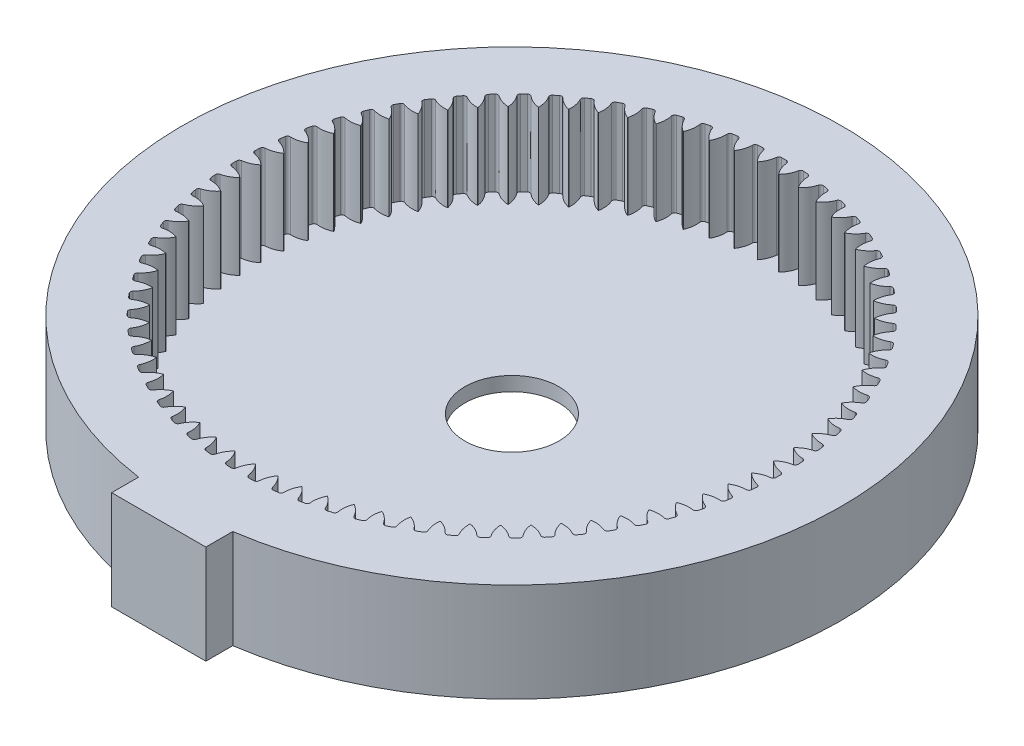
from build123d import *

# Parameters (mm, degrees)
SKETCH1_R                = 70
SKETCH1_R_2              = 54.47
BOSS_EXTRUDE1_DEPTH      = 18
CUT_EXTRUDE1_DEPTH       = 101.618089825
FILLET1_R                = 0.57
CIRPATTERN1_COUNT        = 75
FILLET1_OF_CIRPATTERN1_R = 0.57
BOSS_EXTRUDE2_START      = -3
SKETCH4_R                = 70
BOSS_EXTRUDE2_DEPTH      = 3
CUT_EXTRUDE2_REACH       = 103.198
SKETCH5_R                = 10
SKETCH6_W                = 20
SKETCH6_H                = 8.202228863
BOSS_EXTRUDE3_DEPTH      = 21
SCALE1_SCALE             = 10


with BuildPart() as part:
    # Sketch1 → Boss-Extrude1 (new body)
    with BuildSketch(Plane(origin=(0, 0, 0), x_dir=(1, 0, 0), z_dir=(0, 1, 0))):
        with Locations(Location((0, 0, 0), (0, 0, 270))):
            Circle(SKETCH1_R)
        with Locations(Location((0, 0, 0), (0, 0, 270))):
            Circle(SKETCH1_R_2, mode=Mode.SUBTRACT)
    extrude(amount=BOSS_EXTRUDE1_DEPTH)

    # Sketch2 → Cut-Extrude1 (cut, through all)
    with BuildSketch(Plane(origin=(0, 0, 0), x_dir=(1, 0, 0), z_dir=(0, 1, 0))):
        with BuildLine():
            ThreePointArc((2.253249833, 54.41897462), (1.367107137, 55.988197892), (1.037254549, 57.759894206))
            ThreePointArc((1.037254549, 57.759894206), (0, 57.769206985), (-1.037254549, 57.759894206))
            ThreePointArc((-1.037254549, 57.759894206), (-1.367107137, 55.988197892), (-2.253249833, 54.41897462))
            ThreePointArc((-2.253249833, 54.41897462), (0, 54.465603214), (2.253249833, 54.41897462))
        make_face()
    cut_extrude1 = extrude(amount=CUT_EXTRUDE1_DEPTH, mode=Mode.SUBTRACT)

    # Fillet1
    fillet1_edges = [part.edges().sort_by_distance(p)[0] for p in [
        (1.037254549, 9, -57.759894206),
        (-1.037254549, 9, -57.759894206),
    ]]
    fillet(fillet1_edges, radius=FILLET1_R)

    # CirPattern1: Cut-Extrude1 ×75 about axis
    cirpattern1_axis = Axis((0, 0, 0), (0, 1, 0))
    for i in range(1, CIRPATTERN1_COUNT):
        add(cut_extrude1.rotate(cirpattern1_axis, i * 360 / CIRPATTERN1_COUNT), mode=Mode.SUBTRACT)

    # Fillet1 of CirPattern1
    fillet1_of_cirpattern1_edges = [part.edges().sort_by_distance(p)[0] for p in [
        (-3.799606627, 9, -57.644117351),
        (-5.86684013, 9, -57.470526904),
        (-8.609816292, 9, -57.12400843),
        (-10.655274042, 9, -56.778045147),
        (-13.359634283, 9, -56.203215633),
        (-15.368968863, 9, -55.6873062),
        (-18.015744037, 9, -54.888197661),
        (-19.974861409, 9, -54.20596081),
        (-22.545486292, 9, -53.188178419),
        (-24.440644655, 9, -52.344399552),
        (-26.917088159, 9, -51.115082321),
        (-28.73499434, 9, -50.115679941),
        (-31.099885993, 9, -48.683450647),
        (-32.827788685, 9, -47.535434843),
        (-35.064540471, 9, -45.910339546),
        (-36.690319679, 9, -44.621762824),
        (-38.783242393, 9, -42.815200399),
        (-40.295494442, 9, -41.3951012),
        (-42.229907734, 9, -39.419743384),
        (-43.618025265, 9, -37.878082682),
        (-45.380360615, 9, -35.747785192),
        (-46.634606979, 9, -34.095376631),
        (-48.212502872, 9, -31.825081972),
        (-49.324080433, 9, -30.073516009),
        (-50.706469061, 9, -27.679148668),
        (-51.667580901, 9, -25.840711281),
        (-52.844765803, 9, -23.339066024),
        (-53.648670413, 9, -21.426652529),
        (-54.612394482, 9, -18.835276601),
        (-55.253453048, 9, -16.862301205),
        (-55.996956452, 9, -14.199371245),
        (-56.47067241, 9, -12.179672954),
        (-56.988740007, 9, -9.463867503),
        (-57.291790579, 9, -7.411613047),
        (-57.580788497, 9, -4.661981529),
        (-57.711048001, 9, -2.591566001),
        (-57.768949127, 9, 0.172604895),
        (-57.725503886, 9, 2.246659019),
        (-57.551902086, 9, 5.00598062),
        (-57.335056838, 9, 7.06912534),
        (-56.931169803, 9, 9.804242987),
        (-56.542445561, 9, 11.842006826),
        (-55.911106269, 9, 14.533735635),
        (-55.353229654, 9, 16.531825142),
        (-54.498866496, 9, 19.161284569),
        (-53.775750612, 9, 21.105684584),
        (-52.704356332, 9, 23.65443086),
        (-51.821073318, 9, 25.531502812),
        (-50.540162977, 9, 27.981658313),
        (-49.502908428, 9, 29.778235893),
        (-48.021466691, 9, 32.112614539),
        (-46.837516203, 9, 33.816096044),
        (-45.16593432, 9, 36.018323846),
        (-43.843592454, 9, 37.616760578),
        (-41.993595371, 9, 39.671390491),
        (-40.542137406, 9, 41.153570565),
        (-38.526701523, 9, 43.046190835),
        (-36.956308393, 9, 44.401717823),
        (-34.789570546, 9, 46.119053079),
        (-33.111257431, 9, 47.338418933),
        (-30.808415727, 9, 48.868423302),
        (-29.033954787, 9, 49.943075046),
        (-26.611162008, 9, 51.275016648),
        (-24.752999812, 9, 52.197416373),
        (-22.227250107, 9, 53.321952593),
        (-20.298420328, 9, 54.085630327),
        (-17.687430017, 9, 54.994873353),
        (-15.70146201, 9, 55.594472445),
        (-13.023545314, 9, 56.282044589),
        (-10.994369217, 9, 56.713359283),
        (-8.268309798, 9, 57.174437721),
        (-6.210158824, 9, 57.434442655),
        (-3.45507803, 9, 57.665793253),
        (-1.382388629, 9, 57.752664678),
        (1.382388629, 9, 57.752664678),
        (3.45507803, 9, 57.665793253),
        (6.210158824, 9, 57.434442655),
        (8.268309798, 9, 57.174437721),
        (10.994369217, 9, 56.713359283),
        (13.023545314, 9, 56.282044589),
        (15.70146201, 9, 55.594472445),
        (17.687430017, 9, 54.994873353),
        (20.298420328, 9, 54.085630327),
        (22.227250107, 9, 53.321952593),
        (24.752999812, 9, 52.197416373),
        (26.611162008, 9, 51.275016648),
        (29.033954787, 9, 49.943075046),
        (30.808415727, 9, 48.868423302),
        (33.111257431, 9, 47.338418933),
        (34.789570546, 9, 46.119053079),
        (36.956308393, 9, 44.401717823),
        (38.526701523, 9, 43.046190835),
        (40.542137406, 9, 41.153570565),
        (41.993595371, 9, 39.671390491),
        (43.843592454, 9, 37.616760578),
        (45.16593432, 9, 36.018323846),
        (46.837516203, 9, 33.816096044),
        (48.021466691, 9, 32.112614539),
        (49.502908428, 9, 29.778235893),
        (50.540162977, 9, 27.981658313),
        (51.821073318, 9, 25.531502812),
        (52.704356332, 9, 23.65443086),
        (53.775750612, 9, 21.105684584),
        (54.498866496, 9, 19.161284569),
        (55.353229654, 9, 16.531825142),
        (55.911106269, 9, 14.533735635),
        (56.542445561, 9, 11.842006826),
        (56.931169803, 9, 9.804242987),
        (57.335056838, 9, 7.06912534),
        (57.551902086, 9, 5.00598062),
        (57.725503886, 9, 2.246659019),
        (57.768949127, 9, 0.172604895),
        (57.711048001, 9, -2.591566001),
        (57.580788497, 9, -4.661981529),
        (57.291790579, 9, -7.411613047),
        (56.988740007, 9, -9.463867503),
        (56.47067241, 9, -12.179672954),
        (55.996956452, 9, -14.199371245),
        (55.253453048, 9, -16.862301205),
        (54.612394482, 9, -18.835276601),
        (53.648670413, 9, -21.426652529),
        (52.844765803, 9, -23.339066024),
        (51.667580901, 9, -25.840711281),
        (50.706469061, 9, -27.679148668),
        (49.324080433, 9, -30.073516009),
        (48.212502872, 9, -31.825081972),
        (46.634606979, 9, -34.095376631),
        (45.380360615, 9, -35.747785192),
        (43.618025265, 9, -37.878082682),
        (42.229907734, 9, -39.419743384),
        (40.295494442, 9, -41.3951012),
        (38.783242393, 9, -42.815200399),
        (36.690319679, 9, -44.621762824),
        (35.064540471, 9, -45.910339546),
        (32.827788685, 9, -47.535434843),
        (31.099885993, 9, -48.683450647),
        (28.73499434, 9, -50.115679941),
        (26.917088159, 9, -51.115082321),
        (24.440644655, 9, -52.344399552),
        (22.545486292, 9, -53.188178419),
        (19.974861409, 9, -54.20596081),
        (18.015744037, 9, -54.888197661),
        (15.368968863, 9, -55.6873062),
        (13.359634283, 9, -56.203215633),
        (10.655274042, 9, -56.778045147),
        (8.609816292, 9, -57.12400843),
        (5.86684013, 9, -57.470526904),
        (3.799606627, 9, -57.644117351),
    ]]
    fillet(fillet1_of_cirpattern1_edges, radius=FILLET1_OF_CIRPATTERN1_R)

    # Sketch4 → Boss-Extrude2 (add)
    with BuildSketch(Plane(origin=(0, 0, 0), x_dir=(1, 0, 0), z_dir=(0, 1, 0)).offset(BOSS_EXTRUDE2_START)):
        with Locations(Location((0, 0, 0), (0, 0, 270))):
            Circle(SKETCH4_R)
    extrude(amount=BOSS_EXTRUDE2_DEPTH)

    # Sketch5 → Cut-Extrude2 (cut, up to next)
    with BuildSketch(Plane.XZ.offset(3), mode=Mode.PRIVATE) as cut_extrude2_sk1:
        with Locations(Location((0, 0, 0), (0, 0, 270))):
            Circle(SKETCH5_R)
    cut_extrude2_tool1 = extrude(cut_extrude2_sk1.sketch, amount=-CUT_EXTRUDE2_REACH, mode=Mode.PRIVATE) & part.part
    add(cut_extrude2_tool1.solids().sort_by_distance((0, -3, 0))[0], mode=Mode.SUBTRACT)

    # Sketch6 → Boss-Extrude3 (add, through all)
    with BuildSketch(Plane.XZ.offset(3)):
        with Locations((0, 70.898885568)):
            Rectangle(SKETCH6_W, SKETCH6_H)
    extrude(amount=-BOSS_EXTRUDE3_DEPTH)


with BuildPart() as part_1:
    # Scale1: scaled about (0, 5.682145912, 1.104658211)
    add(part.part.scale(SCALE1_SCALE).moved(Location((0, -51.139313208, -9.941923899))))


solid = part_1.part
